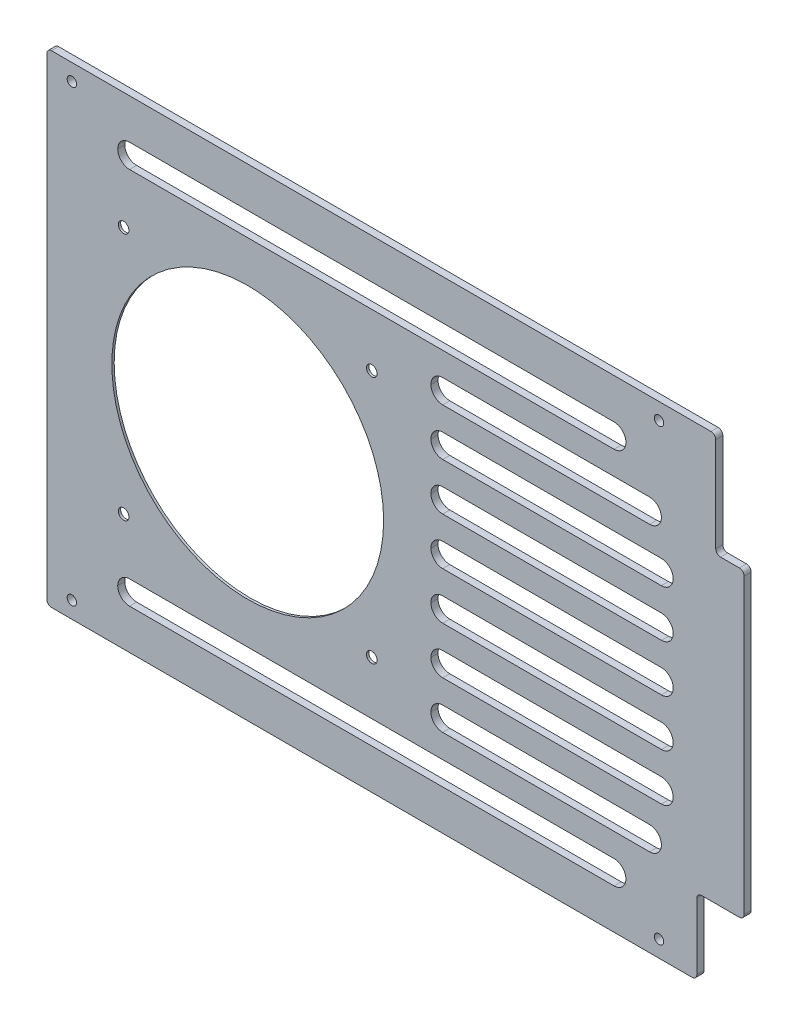
from build123d import *

# Parameters (mm, degrees)
SKETCH_1_W            = 275
SKETCH_1_H            = 204
SKETCH_1_W_2          = 8
SKETCH_1_H_2          = 44
EXTRUDE_1_DEPTH       = 3
SKETCH_2_R            = 2
SKETCH_2_R_2          = 57.5
SKETCH_2_R_3          = 2.25
CUT_EXTRUDE_1_DEPTH   = 3
SKETCH_3_W            = 119.5
SKETCH_3_H            = 119.5
CUT_EXTRUDE_2_DEPTH   = 2
FILLET_1_R            = 2
SKETCH_5_W            = 215
SKETCH_5_H            = 10
SKETCH_5_W_2          = 97.5
SKETCH_5_W_3          = 102.5
CUT_EXTRUDE_1_2_DEPTH = 3
FILLET_2_R            = 5
FILLET_3_R            = 2


with BuildPart() as part:
    # 스케치1 → 보스-돌출1 (new body)
    with BuildSketch(Plane.XY):
        Rectangle(SKETCH_1_W, SKETCH_1_H)
        Polygon((137.5, 58), (137.5, -70), (157.5, -70), (157.5, 58), (145.5, 58), align=None)
        with Locations((141.5, 80)):
            Rectangle(SKETCH_1_W_2, SKETCH_1_H_2)
    extrude(amount=EXTRUDE_1_DEPTH)

    # 스케치2 → Cut-Extrude 1 (cut)
    with BuildSketch(Plane.XY.offset(3)):
        with Locations((-126.9, 95)):
            Circle(SKETCH_2_R)
        with Locations((121.5, 95)):
            Circle(SKETCH_2_R)
        with Locations((-126.9, -95)):
            Circle(SKETCH_2_R)
        with Locations((121.5, -95)):
            Circle(SKETCH_2_R)
        with Locations((-52.5, 0)):
            Circle(SKETCH_2_R_2)
        with Locations((-105, 52.5)):
            Circle(SKETCH_2_R_3)
        with Locations((0, 52.5)):
            Circle(SKETCH_2_R_3)
        with Locations((0, -52.5)):
            Circle(SKETCH_2_R_3)
        with Locations((-105, -52.5)):
            Circle(SKETCH_2_R_3)
    extrude(amount=-CUT_EXTRUDE_1_DEPTH, mode=Mode.SUBTRACT)

    # 스케치3 → 컷-돌출2 (cut)
    with BuildSketch(Plane(origin=(0, 0, 0), x_dir=(-1, 0, 0), z_dir=(0, 0, -1))):
        with Locations((52.5, 0)):
            Rectangle(SKETCH_3_W, SKETCH_3_H)
    extrude(amount=-CUT_EXTRUDE_2_DEPTH, mode=Mode.SUBTRACT)

    # 필렛1
    fillet_1_edges = [part.edges().sort_by_distance(p)[0] for p in [
        (7.25, 59.75, 1),
        (-112.25, 59.75, 1),
        (-112.25, -59.75, 1),
        (7.25, -59.75, 1),
    ]]
    fillet(fillet_1_edges, radius=FILLET_1_R)

    # 스케치5 → Cut-Extrude 1 2 (cut)
    with BuildSketch(Plane.XY.offset(3)):
        with Locations((0, -80)):
            Rectangle(SKETCH_5_W, SKETCH_5_H)
        with Locations((73.75, -60)):
            Rectangle(SKETCH_5_W_2, SKETCH_5_H)
        with Locations((76.25, -40)):
            Rectangle(SKETCH_5_W_3, SKETCH_5_H)
        with Locations((76.25, -20)):
            Rectangle(SKETCH_5_W_3, SKETCH_5_H)
        with Locations((76.25, 0)):
            Rectangle(SKETCH_5_W_3, SKETCH_5_H)
        with Locations((76.25, 20)):
            Rectangle(SKETCH_5_W_3, SKETCH_5_H)
        with Locations((76.25, 40)):
            Rectangle(SKETCH_5_W_3, SKETCH_5_H)
        with Locations((73.75, 60)):
            Rectangle(SKETCH_5_W_2, SKETCH_5_H)
        with Locations((0, 80)):
            Rectangle(SKETCH_5_W, SKETCH_5_H)
    extrude(amount=-CUT_EXTRUDE_1_2_DEPTH, mode=Mode.SUBTRACT)

    # 필렛2
    fillet_2_edges = [part.edges().sort_by_distance(p)[0] for p in [
        (107.5, -85, 1.5),
        (122.5, -65, 1.5),
        (127.5, -45, 1.5),
        (127.5, -25, 1.5),
        (127.5, -5, 1.5),
        (127.5, 15, 1.5),
        (127.5, 35, 1.5),
        (122.5, 55, 1.5),
        (107.5, 75, 1.5),
        (25, 65, 1.5),
        (25, 45, 1.5),
        (25, 25, 1.5),
        (25, 5, 1.5),
        (25, -15, 1.5),
        (25, -35, 1.5),
        (25, -55, 1.5),
        (-107.5, -75, 1.5),
        (25, -65, 1.5),
        (25, -45, 1.5),
        (25, -25, 1.5),
        (25, -5, 1.5),
        (25, 15, 1.5),
        (25, 35, 1.5),
        (25, 55, 1.5),
        (-107.5, -85, 1.5),
        (127.5, 5, 1.5),
        (127.5, -15, 1.5),
        (127.5, -35, 1.5),
        (122.5, -55, 1.5),
        (107.5, -75, 1.5),
        (127.5, 25, 1.5),
        (122.5, 65, 1.5),
        (127.5, 45, 1.5),
        (107.5, 85, 1.5),
        (-107.5, 75, 1.5),
        (-107.5, 85, 1.5),
    ]]
    fillet(fillet_2_edges, radius=FILLET_2_R - 0.0001)  # a hair under: the kernel refuses the full size

    # 필렛3
    fillet_3_edges = [part.edges().sort_by_distance(p)[0] for p in [
        (157.5, 58, 1.5),
        (157.5, -70, 1.5),
        (137.5, -70, 1.5),
        (137.5, -102, 1.5),
        (-137.5, -102, 1.5),
        (-137.5, 102, 1.5),
        (145.5, 102, 1.5),
        (145.5, 58, 1.5),
    ]]
    fillet(fillet_3_edges, radius=FILLET_3_R)


solid = part.part
